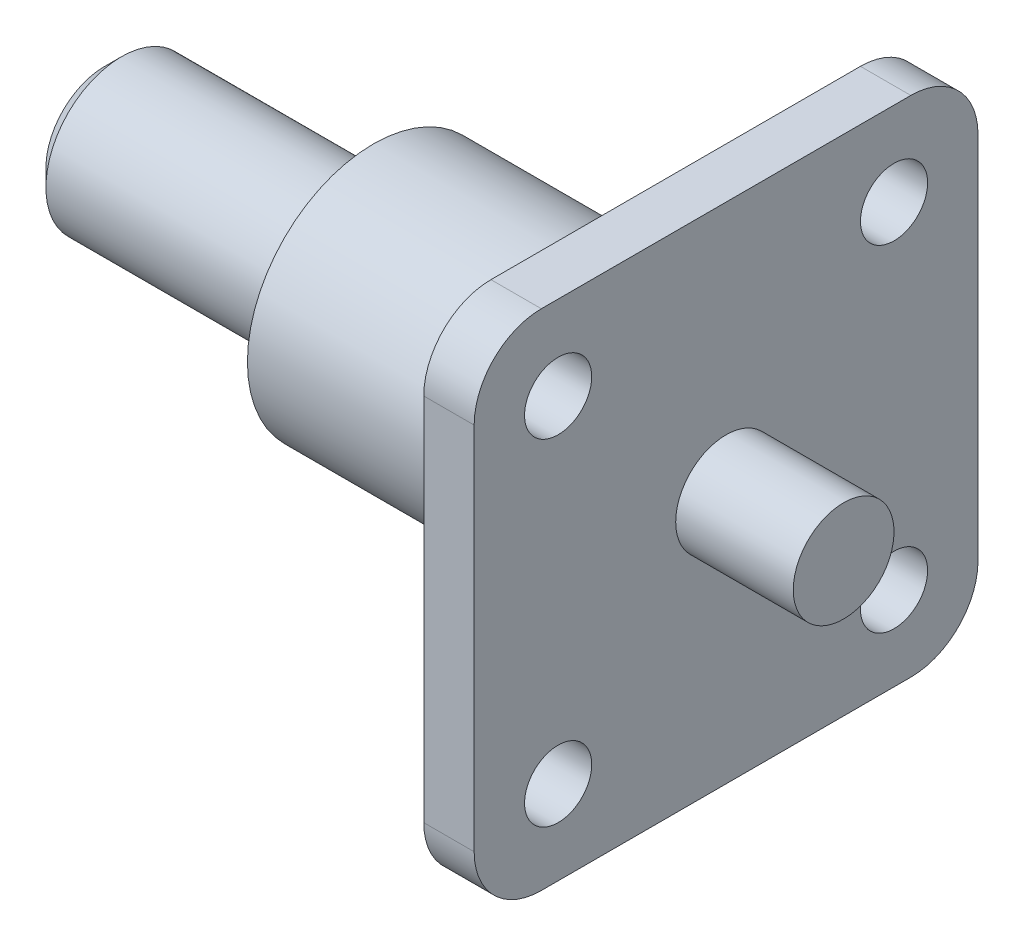
from build123d import *

# Parameters (mm, degrees)
REDONDEO1_R             = 1
CHAFL_N1_SIZE           = 1
CROQUIS2_R              = 2
SALIENTE_EXTRUIR1_DEPTH = 3


with BuildPart() as part:
    # Croquis1 → Revolución1 (revolve)
    with BuildSketch(Plane.XY):
        Polygon((-16, 0), (-16, 4.5), (0, 4.5), (0, 7.5), (18, 7.5), (18, 3), (28, 3), (28, 0), align=None)
    revolve(axis=Axis((-18.371134021, 0, 0), (1, 0, 0)))

    # Redondeo1
    redondeo1_edges = [part.edges().sort_by_distance(p)[0] for p in [
        (0, -4.5, 0),
    ]]
    fillet(redondeo1_edges, radius=REDONDEO1_R)

    # Chaflán1
    chafl_n1_edges = [part.edges().sort_by_distance(p)[0] for p in [
        (-16, -4.5, 0),
    ]]
    chamfer(chafl_n1_edges, length=CHAFL_N1_SIZE)

    # Croquis2 → Saliente-Extruir1 (add)
    with BuildSketch(Plane(origin=(18, 0, 0), x_dir=(0, 0, -1), z_dir=(1, 0, 0))):
        with BuildLine():
            Line((-11, -15), (11, -15))
            ThreePointArc((11, -15), (13.828427125, -13.828427125), (15, -11))
            Line((15, -11), (15, 11))
            ThreePointArc((15, 11), (13.828427125, 13.828427125), (11, 15))
            Line((11, 15), (-11, 15))
            ThreePointArc((-11, 15), (-13.828427125, 13.828427125), (-15, 11))
            Line((-15, 11), (-15, -11))
            ThreePointArc((-15, -11), (-13.828427125, -13.828427125), (-11, -15))
        make_face()
        with Locations((-10, 10)):
            Circle(CROQUIS2_R, mode=Mode.SUBTRACT)
        with Locations((10, 10)):
            Circle(CROQUIS2_R, mode=Mode.SUBTRACT)
        with Locations((10, -10)):
            Circle(CROQUIS2_R, mode=Mode.SUBTRACT)
        with Locations((-10, -10)):
            Circle(CROQUIS2_R, mode=Mode.SUBTRACT)
    extrude(amount=SALIENTE_EXTRUIR1_DEPTH)


solid = part.part
